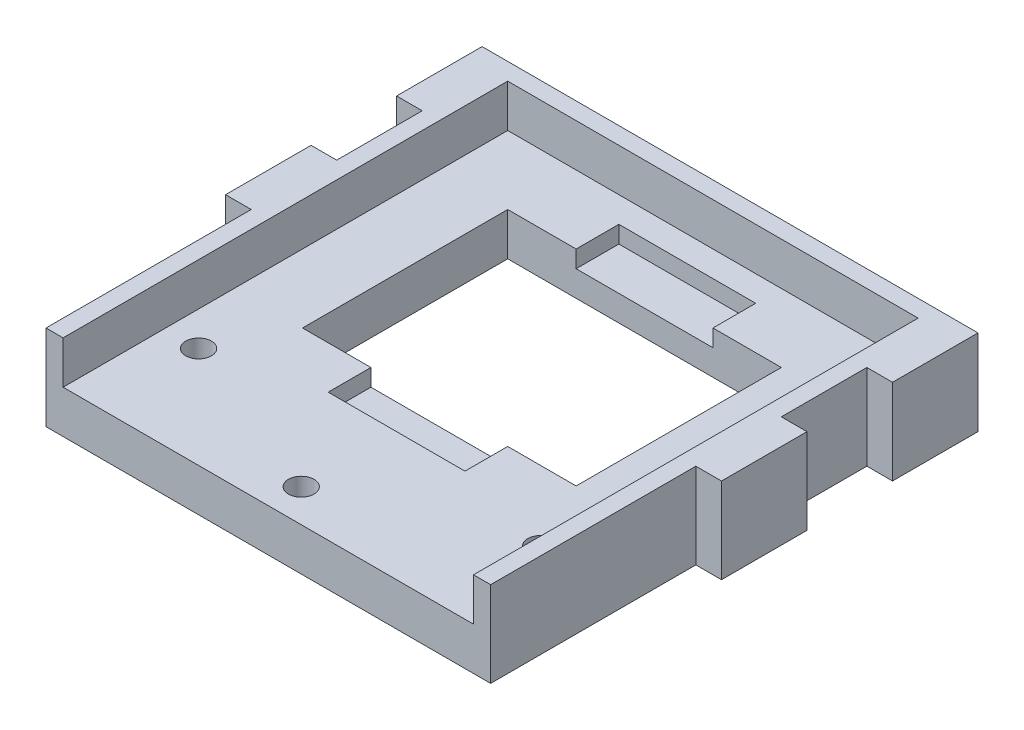
from build123d import *

# Parameters (mm, degrees)
SKETCH1_W               = 52
SKETCH1_H               = 54
SKETCH1_W_2             = 32
SKETCH1_H_2             = 24
BOSS_EXTRUDE1_DEPTH     = 10
SKETCH2_W               = 48
SKETCH2_H               = 52
CUT_EXTRUDE1_DEPTH      = 5
SKETCH3_W               = 16
SKETCH3_H               = 5
CUT_EXTRUDE2_DEPTH      = 2
SKETCH4_R               = 1.5
CUT_EXTRUDE3_DEPTH      = 5
SKETCH6_W               = 3
SKETCH6_H               = 10
BOSS_EXTRUDE2_DEPTH     = 10
LPATTERN1_COUNT         = 2
LPATTERN1_PITCH         = 20
MIRROR1_COPY_1_SKETCH_W = 3
MIRROR1_COPY_1_SKETCH_H = 10
MIRROR1_COPY_1_DEPTH    = 10
MIRROR1_COPY_2_SKETCH_W = 3
MIRROR1_COPY_2_SKETCH_H = 10
MIRROR1_COPY_2_DEPTH    = 10


with BuildPart() as part:
    # Sketch1 → Boss-Extrude1 (new body)
    with BuildSketch(Plane(origin=(0, 0, 0), x_dir=(1, 0, 0), z_dir=(0, 1, 0))):
        Rectangle(SKETCH1_W, SKETCH1_H)
        with Locations((0, 5)):
            Rectangle(SKETCH1_W_2, SKETCH1_H_2, mode=Mode.SUBTRACT)
    extrude(amount=BOSS_EXTRUDE1_DEPTH)

    # Sketch2 → Cut-Extrude1 (cut)
    with BuildSketch(Plane(origin=(0, 10, 0), x_dir=(-1, 0, 0), z_dir=(0, 1, 0))):
        with Locations((0, 1)):
            Rectangle(SKETCH2_W, SKETCH2_H)
    extrude(amount=-CUT_EXTRUDE1_DEPTH, mode=Mode.SUBTRACT)

    # Sketch3 → Cut-Extrude2 (cut)
    with BuildSketch(Plane(origin=(0, 5, 0), x_dir=(-1, 0, 0), z_dir=(0, 1, 0))):
        with Locations((0, -19.5)):
            Rectangle(SKETCH3_W, SKETCH3_H)
        with Locations((0, 9.5)):
            Rectangle(SKETCH3_W, SKETCH3_H)
    extrude(amount=-CUT_EXTRUDE2_DEPTH, mode=Mode.SUBTRACT)

    # Sketch4 → Cut-Extrude3 (cut)
    with BuildSketch(Plane(origin=(0, 5, 0), x_dir=(1, 0, 0), z_dir=(0, 1, 0))):
        with Locations((-20, -15.152442668)):
            Circle(SKETCH4_R)
        with Locations((0, -23.152442668)):
            Circle(SKETCH4_R)
        with Locations((20, -15.152442668)):
            Circle(SKETCH4_R)
    extrude(amount=-CUT_EXTRUDE3_DEPTH, mode=Mode.SUBTRACT)

    # Sketch6 → Boss-Extrude2 (add)
    with BuildSketch(Plane(origin=(0, 10, 0), x_dir=(1, 0, 0), z_dir=(0, 1, 0))):
        with Locations((-27.5, 22)):
            Rectangle(SKETCH6_W, SKETCH6_H)
    boss_extrude2 = extrude(amount=-BOSS_EXTRUDE2_DEPTH)

    # LPattern1: Boss-Extrude2 ×2
    with Locations(*[(0, 0, i * LPATTERN1_PITCH) for i in range(1, LPATTERN1_COUNT)]):
        add(boss_extrude2)

    # Mirror1 copy 1 sketch → Mirror1 copy 1 (add)
    with BuildSketch(Plane(origin=(0, 10, 20), x_dir=(-1, 0, 0), z_dir=(0, 1, 0))):
        with Locations((-27.5, -22)):
            Rectangle(MIRROR1_COPY_1_SKETCH_W, MIRROR1_COPY_1_SKETCH_H)
    extrude(amount=-MIRROR1_COPY_1_DEPTH)

    # Mirror1 copy 2 sketch → Mirror1 copy 2 (add)
    with BuildSketch(Plane(origin=(0, 10, 0), x_dir=(-1, 0, 0), z_dir=(0, 1, 0))):
        with Locations((-27.5, -22)):
            Rectangle(MIRROR1_COPY_2_SKETCH_W, MIRROR1_COPY_2_SKETCH_H)
    extrude(amount=-MIRROR1_COPY_2_DEPTH)


solid = part.part
